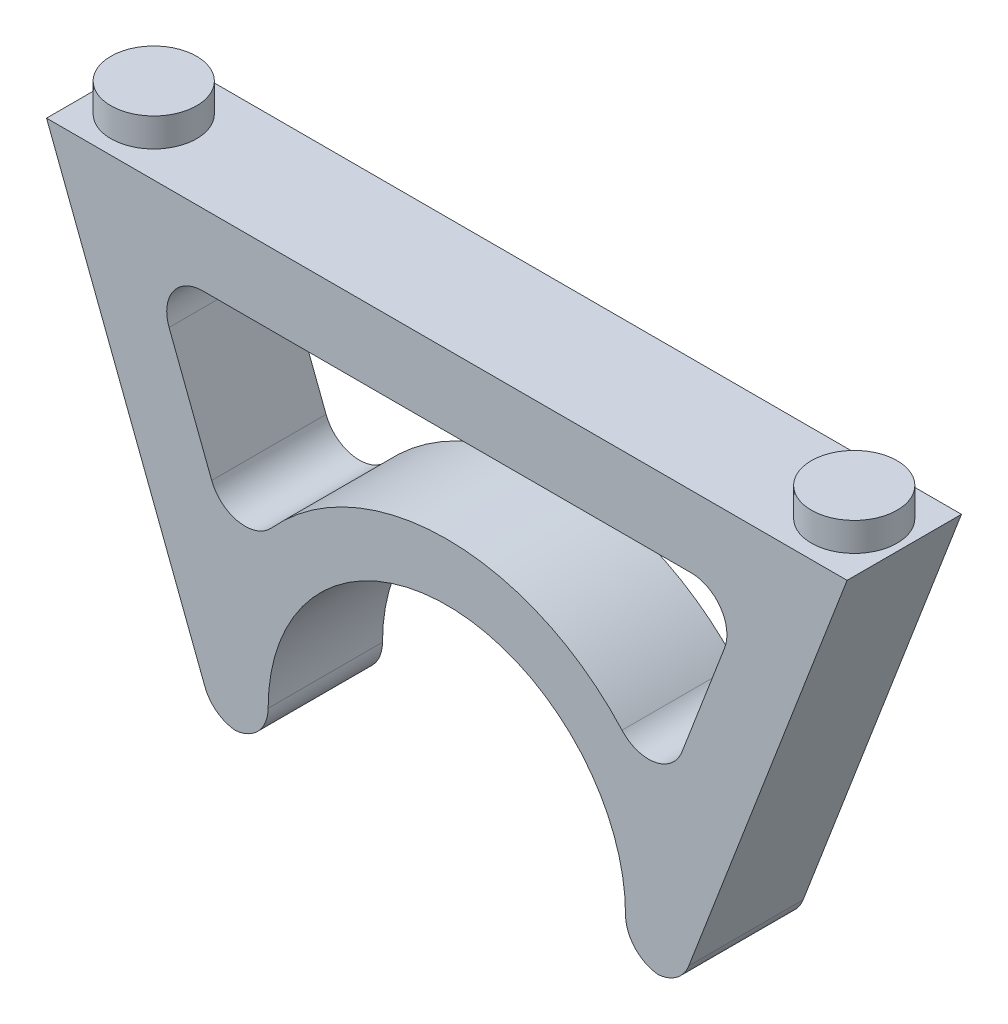
from build123d import *

# Parameters (mm, degrees)
BOSS_EXTRUDE1_DEPTH = 8
CUT_EXTRUDE1_DEPTH  = 43.16930163
FILLET1_R           = 2.5
SKETCH3_R           = 3
BOSS_EXTRUDE2_DEPTH = 2


with BuildPart() as part:
    # Sketch1 → Boss-Extrude1 (new body)
    with BuildSketch(Plane.XY):
        with BuildLine():
            Line((-28, 0), (28, 0))
            Line((28, 0), (16.30950643, -30.5))
            Line((16.30950643, -30.5), (12.247448714, -30.5))
            ThreePointArc((12.247448714, -30.5), (0, -15.5), (-12.247448714, -30.5))
            Line((-12.247448714, -30.5), (-16.30950643, -30.5))
            Line((-16.30950643, -30.5), (-28, 0))
        make_face()
    extrude(amount=BOSS_EXTRUDE1_DEPTH)

    # Sketch2 → Cut-Extrude1 (cut, through all)
    with BuildSketch(Plane.XY.offset(8)):
        with BuildLine():
            Line((-20.728819868, -5), (-14.748606624, -20.602121746))
            ThreePointArc((-14.748606624, -20.602121746), (0, -11.5), (14.748606624, -20.602121746))
            Line((14.748606624, -20.602121746), (20.728819868, -5))
            Line((20.728819868, -5), (-20.728819868, -5))
        make_face()
    extrude(amount=-CUT_EXTRUDE1_DEPTH, mode=Mode.SUBTRACT)

    # Fillet1
    # the kernel refuses this fillet: 2.5 mm, written as the material it adds along each edge
    with BuildSketch(Plane(origin=(14.748606624, -20.602121746, 8), x_dir=(0.35790469832996064, 0.9337581201324783, 0), z_dir=(0, 0, -1))) as fillet1_piece_1:
        with BuildLine():
            CenterArc((4.743679492, -2.5), FILLET1_R, 90, 116.993489573)
            ThreePointArc((2.516034231, -3.634723133), (1.38029262, -1.732719809), (0, 0))
            Line((0, 0), (4.743679492, 0))
        make_face()
    extrude(amount=8)
    with BuildSketch(Plane(origin=(20.728819868, -5, 8), x_dir=(-0.35790469832996097, -0.9337581201324782, 0), z_dir=(0, 0, -1))) as fillet1_piece_2:
        with BuildLine():
            CenterArc((FILLET1_R * 1.4542360265, FILLET1_R), FILLET1_R, 159.028427988, 110.971572012)
            Line((FILLET1_R * 0.520477906364, FILLET1_R * 1.35790469833), (0, 0))
            Line((0, 0), (FILLET1_R * 1.4542360265, 0))
        make_face()
    extrude(amount=8)
    with BuildSketch(Plane(origin=(-20.728819868, -5, 8), x_dir=(0.35790469832996097, -0.9337581201324782, 0), z_dir=(0, 0, -1))) as fillet1_piece_3:
        with BuildLine():
            CenterArc((FILLET1_R * 1.4542360265, -FILLET1_R), FILLET1_R, 90, 110.971572012)
            Line((FILLET1_R * 0.520477906364, -FILLET1_R * 1.35790469833), (0, 0))
            Line((0, 0), (FILLET1_R * 1.4542360265, 0))
        make_face()
    extrude(amount=8)
    with BuildSketch(Plane(origin=(-14.748606624, -20.602121746, 8), x_dir=(0.5640537125230959, 0.8257380997561593, 0), z_dir=(0, 0, -1))) as fillet1_piece_4:
        with BuildLine():
            CenterArc((4.755486169, -2.477467743), FILLET1_R, 97.698333221, 116.993489574)
            Line((2.69992297, -3.900373197), (0, 0))
            ThreePointArc((0, 0), (2.210296389, -0.148712899), (4.420592777, 0))
        make_face()
    extrude(amount=8)
    # the kernel refuses this fillet: 2.5 mm, written as the material it takes off along each edge
    with BuildSketch(Plane(origin=(12.247448714, -30.5, -6.881378215), x_dir=(1, 0, 0), z_dir=(0, 0, 1))) as fillet1_2_piece_1:
        with BuildLine():
            CenterArc((2.752551286, 2.5), FILLET1_R, 180, 90)
            ThreePointArc((0.252551286, 2.5), (0.189253199, 1.243637975), (0, 0))
            Line((0, 0), (2.752551286, 0))
        make_face()
    extrude(amount=21.76275643, mode=Mode.SUBTRACT)
    with BuildSketch(Plane(origin=(16.30950643, -30.5, -4.297789276), x_dir=(0.3579046983299623, 0.9337581201324777, 0), z_dir=(0, 0, 1))) as fillet1_2_piece_2:
        with BuildLine():
            CenterArc((FILLET1_R * 0.687646284221, FILLET1_R), FILLET1_R, 200.971572012, 69.028427988)
            Line((-FILLET1_R * 0.246111835912, FILLET1_R * 0.64209530167), (0, 0))
            Line((0, 0), (FILLET1_R * 0.687646284221, 0))
        make_face()
    extrude(amount=16.595578553, mode=Mode.SUBTRACT)
    with BuildSketch(Plane(origin=(-12.247448714, -30.5, -6.881378215), x_dir=(-1, 0, 0), z_dir=(0, 0, 1))) as fillet1_2_piece_3:
        with BuildLine():
            CenterArc((2.752551286, -2.5), FILLET1_R, 90, 90)
            ThreePointArc((0.252551286, -2.5), (0.189253199, -1.243637975), (0, 0))
            Line((0, 0), (2.752551286, 0))
        make_face()
    extrude(amount=21.76275643, mode=Mode.SUBTRACT)
    with BuildSketch(Plane(origin=(-16.30950643, -30.5, -4.297789276), x_dir=(-0.3579046983299605, 0.9337581201324784, 0), z_dir=(0, 0, 1))) as fillet1_2_piece_4:
        with BuildLine():
            CenterArc((FILLET1_R * 0.687646284221, -FILLET1_R), FILLET1_R, 90, 69.028427988)
            Line((-FILLET1_R * 0.246111835912, -FILLET1_R * 0.64209530167), (0, 0))
            Line((0, 0), (FILLET1_R * 0.687646284221, 0))
        make_face()
    extrude(amount=16.595578553, mode=Mode.SUBTRACT)

    # Sketch3 → Boss-Extrude2 (add)
    with BuildSketch(Plane(origin=(0, 0, 0), x_dir=(1, 0, 0), z_dir=(0, 1, 0))):
        with Locations(Location((-24.5, -4, 0), (0, 0, 180))):
            Circle(SKETCH3_R)
        with Locations(Location((24.5, -4, 0), (0, 0, 180))):
            Circle(SKETCH3_R)
    extrude(amount=BOSS_EXTRUDE2_DEPTH)


solid = part.part
